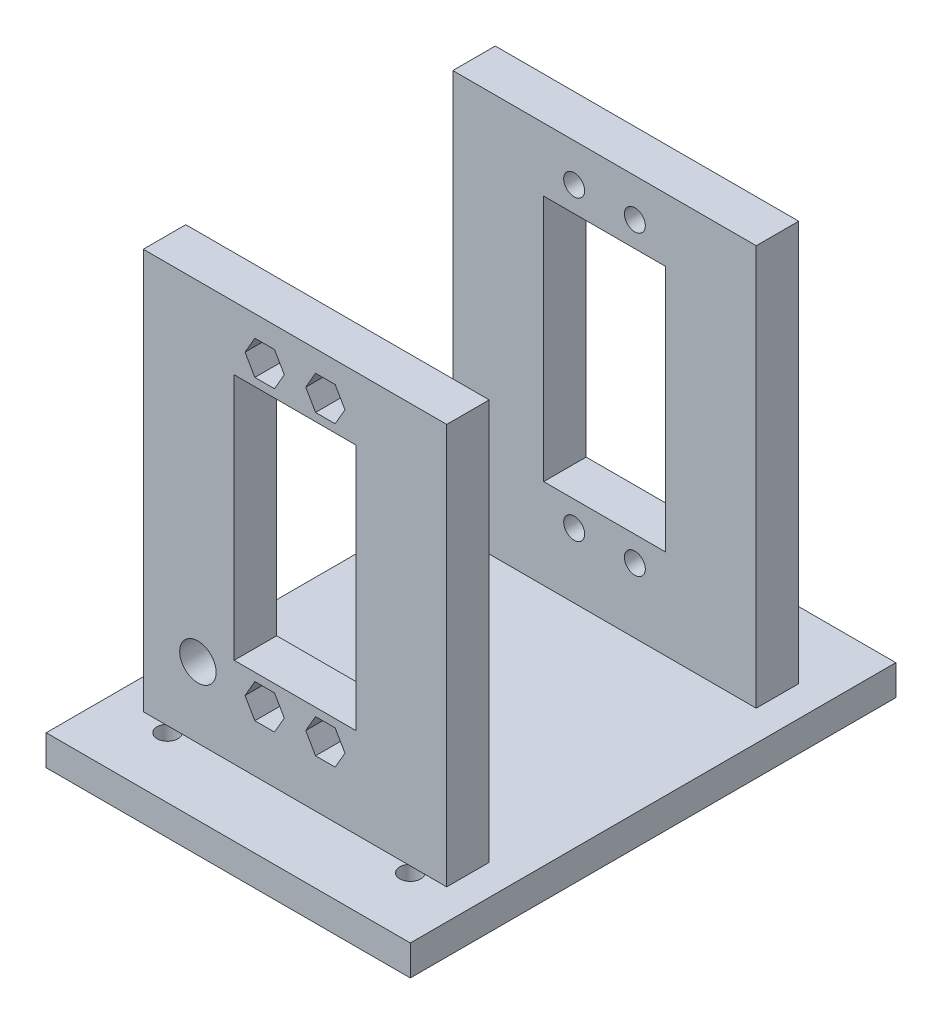
from build123d import *

# Parameters (mm, degrees)
SKETCH1_W           = 60
SKETCH1_H           = 80
BOSS_EXTRUDE1_DEPTH = 2.5
SKETCH2_R           = 1.725
CUT_EXTRUDE1_DEPTH  = 51.249378106
SKETCH3_W           = 50
SKETCH3_H           = 66
BOSS_EXTRUDE2_DEPTH = 7
SKETCH4_W           = 20.05
SKETCH4_H           = 40.75
CUT_EXTRUDE2_DEPTH  = 102.750921372
SKETCH5_R           = 1.725
CUT_EXTRUDE3_DEPTH  = 102.750921372
CUT_EXTRUDE4_DEPTH  = 4.2
CUT_EXTRUDE5_START  = 21
SKETCH7_R           = 3
CUT_EXTRUDE5_DEPTH  = 9


with BuildPart() as part:
    # Sketch1 → Boss-Extrude1 (new, symmetric)
    with BuildSketch(Plane(origin=(0, 0, 0), x_dir=(1, 0, 0), z_dir=(0, 1, 0))):
        Rectangle(SKETCH1_W, SKETCH1_H)
    extrude(amount=BOSS_EXTRUDE1_DEPTH, both=True)

    # Sketch2 → Cut-Extrude1 (cut, through all)
    with BuildSketch(Plane(origin=(0, 2.5, 0), x_dir=(1, 0, 0), z_dir=(0, 1, 0))):
        with Locations((-20, 30)):
            Circle(SKETCH2_R)
        with Locations((20, 30)):
            Circle(SKETCH2_R)
        with Locations((20, -30)):
            Circle(SKETCH2_R)
        with Locations((-20, -30)):
            Circle(SKETCH2_R)
    extrude(amount=-CUT_EXTRUDE1_DEPTH, mode=Mode.SUBTRACT)

    # Sketch3 → Boss-Extrude2 (add)
    with BuildSketch(Plane.XY.offset(22)):
        with Locations((0, 35.5)):
            Rectangle(SKETCH3_W, SKETCH3_H)
    boss_extrude2 = extrude(amount=BOSS_EXTRUDE2_DEPTH)

    # Mirror1: Boss-Extrude2 across plane
    add(boss_extrude2.mirror(Plane.XY))

    # Sketch4 → Cut-Extrude2 (cut, through all)
    with BuildSketch(Plane.XY.offset(29)):
        with Locations((0, 37.7)):
            Rectangle(SKETCH4_W, SKETCH4_H)
    extrude(amount=-CUT_EXTRUDE2_DEPTH, mode=Mode.SUBTRACT)

    # Sketch5 → Cut-Extrude3 (cut, through all)
    with BuildSketch(Plane.XY.offset(29)):
        with Locations((-5, 62.2)):
            Circle(SKETCH5_R)
        with Locations((5, 62.2)):
            Circle(SKETCH5_R)
        with Locations((-5, 13.2)):
            Circle(SKETCH5_R)
        with Locations((5, 13.2)):
            Circle(SKETCH5_R)
    extrude(amount=-CUT_EXTRUDE3_DEPTH, mode=Mode.SUBTRACT)

    # Sketch6 → Cut-Extrude4 (cut)
    with BuildSketch(Plane.XY.offset(29)):
        Polygon((-1.766838493, 62.2), (-3.383419246, 65), (-6.616580754, 65), (-8.233161507, 62.2), (-6.616580754, 59.4), (-3.383419246, 59.4), align=None)
        Polygon((1.766838493, 62.2), (3.383419246, 59.4), (6.616580754, 59.4), (8.233161507, 62.2), (6.616580754, 65), (3.383419246, 65), align=None)
        Polygon((-1.766838493, 13.2), (-3.383419246, 16), (-6.616580754, 16), (-8.233161507, 13.2), (-6.616580754, 10.4), (-3.383419246, 10.4), align=None)
        Polygon((8.233161507, 13.2), (6.616580754, 16), (3.383419246, 16), (1.766838493, 13.2), (3.383419246, 10.4), (6.616580754, 10.4), align=None)
    cut_extrude4 = extrude(amount=-CUT_EXTRUDE4_DEPTH, mode=Mode.SUBTRACT)

    # Mirror3: Cut-Extrude4 across plane
    add(cut_extrude4.mirror(Plane.XY), mode=Mode.SUBTRACT)

    # Sketch7 → Cut-Extrude5 (cut)
    with BuildSketch(Plane.XY.offset(CUT_EXTRUDE5_START)):
        with Locations((-16, 14.1)):
            Circle(SKETCH7_R)
    extrude(amount=CUT_EXTRUDE5_DEPTH, mode=Mode.SUBTRACT)


solid = part.part
